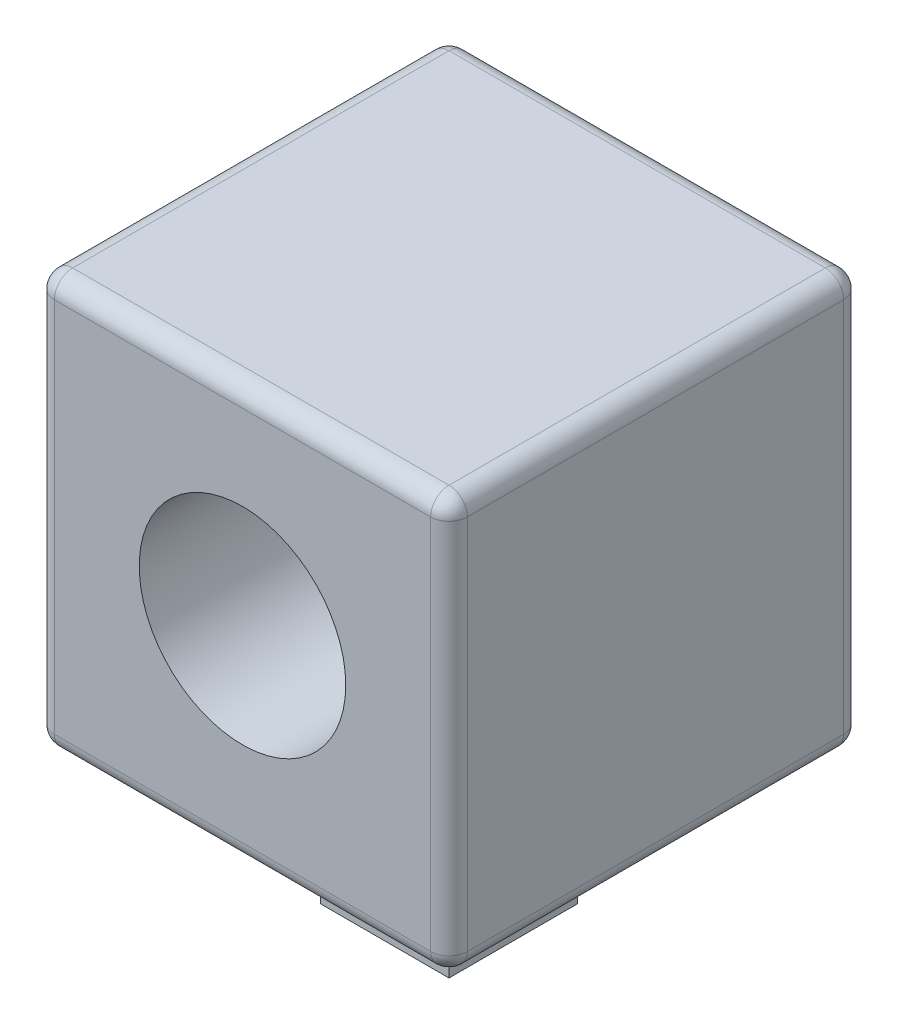
from build123d import *

# Parameters (mm, degrees)
BOSS_EXTRUDE1_DEPTH      = 12.7
BOSS_EXTRUDE1_DEPTH_BACK = 6.35
SKETCH1_W                = 17.78
SKETCH1_H                = 17.78
SKETCH2_W                = 57.15
SKETCH2_H                = 57.15
BOSS_EXTRUDE2_DEPTH      = 57.15
SKETCH3_R                = 14.2875
CUT_EXTRUDE1_DEPTH       = 95.666127126
FILLET1_R                = 2.54


with BuildPart() as part:
    # Sketch1 → Boss-Extrude1 (new, two sides: drawn at the far end of the back side and taken through both)
    with BuildSketch(Plane(origin=(0, 0, 0), x_dir=(1, 0, 0), z_dir=(0, 1, 0)).offset(-BOSS_EXTRUDE1_DEPTH_BACK)):
        Rectangle(SKETCH1_W, SKETCH1_H)
    extrude(amount=BOSS_EXTRUDE1_DEPTH + BOSS_EXTRUDE1_DEPTH_BACK)

    # Sketch2 → Boss-Extrude2 (add)
    with BuildSketch(Plane(origin=(0, 12.7, 0), x_dir=(1, 0, 0), z_dir=(0, 1, 0))):
        Rectangle(SKETCH2_W, SKETCH2_H)
    extrude(amount=BOSS_EXTRUDE2_DEPTH)

    # Sketch3 → Cut-Extrude1 (cut, through all)
    with BuildSketch(Plane.XY.offset(28.575)):
        with Locations((0, 41.275)):
            Circle(SKETCH3_R)
    extrude(amount=-CUT_EXTRUDE1_DEPTH, mode=Mode.SUBTRACT)

    # Fillet1
    fillet1_edges = [part.edges().sort_by_distance(p)[0] for p in [
        (28.575, 69.85, 0),
        (28.575, 12.7, 0),
        (-28.575, 69.85, 0),
        (-28.575, 12.7, 0),
        (28.575, 41.275, -28.575),
        (0, 69.85, -28.575),
        (-28.575, 41.275, -28.575),
        (0, 12.7, -28.575),
        (-28.575, 41.275, 28.575),
        (0, 69.85, 28.575),
        (28.575, 41.275, 28.575),
        (0, 12.7, 28.575),
    ]]
    fillet(fillet1_edges, radius=FILLET1_R)


solid = part.part
